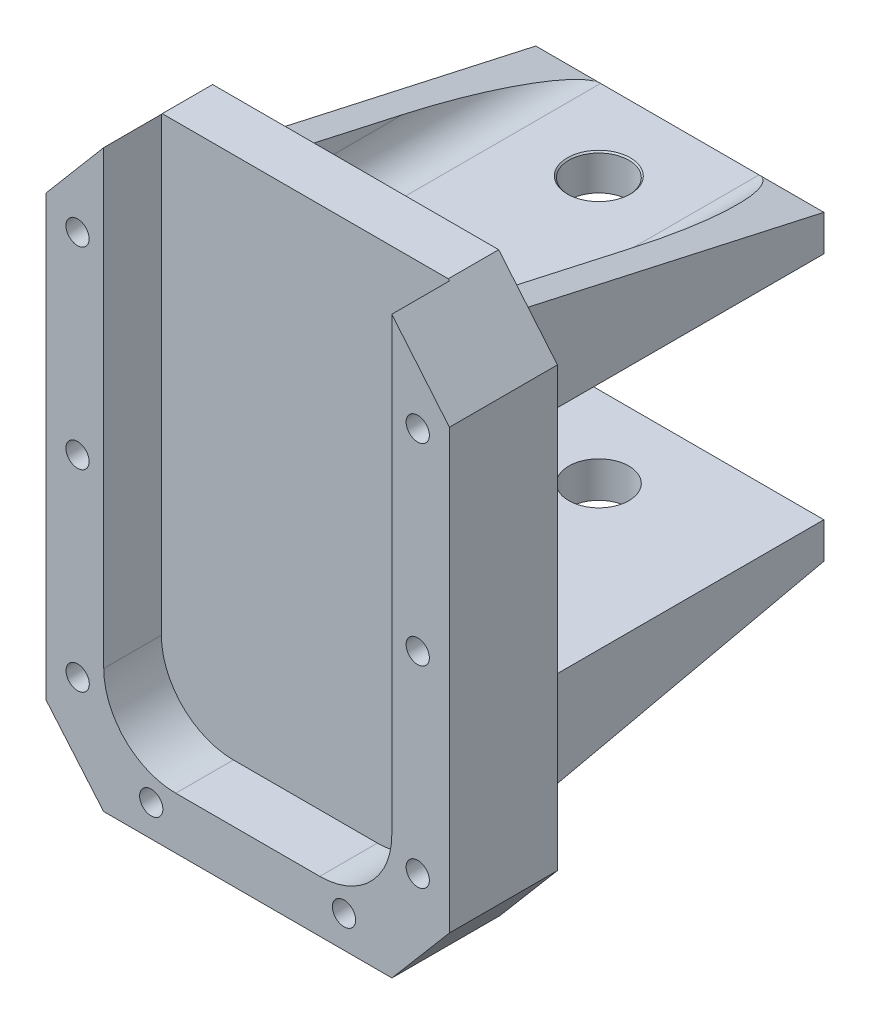
from build123d import *

# Parameters (mm, degrees)
SKETCH1_W                      = 35.56
SKETCH1_H                      = 50.8
BOSS_EXTRUDE1_DEPTH            = 9.525
SKETCH2_W                      = 25.4
SKETCH2_H                      = 46.22
CUT_EXTRUDE2_DEPTH             = 5.08
TAP_DRILL_FOR_M2_5X0_45_TAP1_D = 2.05
SKETCH13_W                     = 25.4
SKETCH13_H                     = 3.175
BOSS_EXTRUDE2_DEPTH            = 28.575
CUT_EXTRUDE3_DEPTH             = 73.778867812
FILLET1_R                      = 6.35
M5_CLEARANCE_HOLE1_D           = 5.3
M5_CLEARANCE_HOLE1_CSINK_D     = 5.55
M5_CLEARANCE_HOLE1_CSINK_ANGLE = 90
RIB7_REACH                     = 67.774
SKETCH14_WALL_W                = 162.819779212
SKETCH14_WALL_H                = 2.54
RIB8_REACH                     = 67.774
SKETCH15_WALL_W                = 162.819779212
SKETCH15_WALL_H                = 2.54
RIB9_REACH                     = 67.774
SKETCH17_WALL_W                = 162.819779212
SKETCH17_WALL_H                = 2.54
RIB10_REACH                    = 67.774
SKETCH16_WALL_W                = 162.819779212
SKETCH16_WALL_H                = 2.54
FILLET2_R                      = 3.175
FILLET3_R                      = 3.175


with BuildPart() as part:
    # Sketch1 → Boss-Extrude1 (new body)
    with BuildSketch(Plane.XY):
        with Locations((-17.78, 25.4)):
            Rectangle(SKETCH1_W, SKETCH1_H)
    extrude(amount=BOSS_EXTRUDE1_DEPTH)

    # Sketch2 → Cut-Extrude2 (cut)
    with BuildSketch(Plane.XY.offset(9.525)):
        with Locations((-17.78, 27.69)):
            Rectangle(SKETCH2_W, SKETCH2_H)
    extrude(amount=-CUT_EXTRUDE2_DEPTH, mode=Mode.SUBTRACT)

    # Tap Drill for M2.5x0.45 Tap1 (through all)
    with Locations(Plane(origin=(0, 0, 0), x_dir=(-1, 0, 0), z_dir=(0, 0, -1))):
        with Locations((2.792369004, 43.087106138), (2.792369004, 26.092979092), (2.792369004, 9.105182099), (9.290740849, 2.822744672), (26.292369004, 2.787106138), (32.780032006, 9.105182099), (32.792369004, 26.087106138), (32.792369004, 43.087106138)):
            Hole(TAP_DRILL_FOR_M2_5X0_45_TAP1_D / 2)

    # Sketch13 → Boss-Extrude2 (add)
    with BuildSketch(Plane(origin=(0, 0, 0), x_dir=(-1, 0, 0), z_dir=(0, 0, -1))):
        with Locations((17.78, 37.827545037)):
            Rectangle(SKETCH13_W, SKETCH13_H)
        with Locations((17.78, 14.352545037)):
            Rectangle(SKETCH13_W, SKETCH13_H)
    extrude(amount=BOSS_EXTRUDE2_DEPTH)

    # Sketch8 → Cut-Extrude3 (cut, through all)
    with BuildSketch(Plane.XY.offset(9.525)):
        Polygon((-5.178964387, 50.8), (0, 44.591495864), (0, 50.8), align=None)
        Polygon((-35.56, 44.706622517), (-35.56, 50.8), (-30.402645731, 50.8), align=None)
        Polygon((-35.56, 5.970049098), (-35.56, 0), (-30.492594088, 0), align=None)
        Polygon((-5.092594088, -0.031324356), (0, 0), (0, 5.970049098), align=None)
    extrude(amount=-CUT_EXTRUDE3_DEPTH, mode=Mode.SUBTRACT)

    # Fillet1
    fillet1_edges = [part.edges().sort_by_distance(p)[0] for p in [
        (-5.08, 4.58, 6.985),
        (-30.48, 4.58, 6.985),
    ]]
    fillet(fillet1_edges, radius=FILLET1_R)

    # M5 Clearance Hole1 (through all)
    with Locations(Plane(origin=(-17.78, 39.415045037, -7.14375), x_dir=(0, 0, 1), z_dir=(0, 1, 0))):
        with Locations((0, 0), (-14.2875, 0)):
            CounterSinkHole(M5_CLEARANCE_HOLE1_D / 2, M5_CLEARANCE_HOLE1_CSINK_D / 2, counter_sink_angle=M5_CLEARANCE_HOLE1_CSINK_ANGLE)

    # Sketch14 wall → Rib7 (add, up to next)
    with BuildSketch(Plane(origin=(-30.48, 9.590045037, -14.2875), x_dir=(0, -0.216930457819, 0.976187060184), z_dir=(0, 0.976187060184, 0.216930457819)), mode=Mode.PRIVATE) as rib7_sk1:
        with Locations((0, 1.27)):
            Rectangle(SKETCH14_WALL_W, SKETCH14_WALL_H)
    rib7_tool1 = extrude(rib7_sk1.sketch, amount=RIB7_REACH, mode=Mode.PRIVATE) - part.part
    add(rib7_tool1.solids().sort_by_distance((-30.48, 9.590045037, -14.2875))[0])

    # Sketch15 wall → Rib8 (add, up to next)
    with BuildSketch(Plane(origin=(-5.08, 9.590045037, -14.2875), x_dir=(0, -0.216930457819, 0.976187060184), z_dir=(0, -0.976187060184, -0.216930457819)), mode=Mode.PRIVATE) as rib8_sk1:
        with Locations((0, 1.27)):
            Rectangle(SKETCH15_WALL_W, SKETCH15_WALL_H)
    rib8_tool1 = extrude(rib8_sk1.sketch, amount=-RIB8_REACH, mode=Mode.PRIVATE) - part.part
    add(rib8_tool1.solids().sort_by_distance((-5.08, 9.590045037, -14.2875))[0])

    # Sketch17 wall → Rib9 (add, up to next)
    with BuildSketch(Plane(origin=(-5.08, 42.590045037, -14.2875), x_dir=(0, 0.216930457819, 0.976187060184), z_dir=(0, -0.976187060184, 0.216930457819)), mode=Mode.PRIVATE) as rib9_sk1:
        with Locations((0, 1.27)):
            Rectangle(SKETCH17_WALL_W, SKETCH17_WALL_H)
    rib9_tool1 = extrude(rib9_sk1.sketch, amount=RIB9_REACH, mode=Mode.PRIVATE) - part.part
    add(rib9_tool1.solids().sort_by_distance((-5.08, 42.590045037, -14.2875))[0])

    # Sketch16 wall → Rib10 (add, up to next)
    with BuildSketch(Plane(origin=(-30.48, 42.590045037, -14.2875), x_dir=(0, 0.216930457819, 0.976187060184), z_dir=(0, 0.976187060184, -0.216930457819)), mode=Mode.PRIVATE) as rib10_sk1:
        with Locations((0, 1.27)):
            Rectangle(SKETCH16_WALL_W, SKETCH16_WALL_H)
    rib10_tool1 = extrude(rib10_sk1.sketch, amount=-RIB10_REACH, mode=Mode.PRIVATE) - part.part
    add(rib10_tool1.solids().sort_by_distance((-30.48, 42.590045037, -14.2875))[0])

    # Fillet2
    fillet2_edges = [part.edges().sort_by_distance(p)[0] for p in [
        (-27.94, 12.765045037, -14.2875),
        (-7.62, 12.765045037, -14.2875),
    ]]
    fillet(fillet2_edges, radius=FILLET2_R)

    # Fillet3
    fillet3_edges = [part.edges().sort_by_distance(p)[0] for p in [
        (-7.62, 39.415045037, -14.2875),
        (-27.94, 39.415045037, -14.2875),
    ]]
    fillet(fillet3_edges, radius=FILLET3_R)


solid = part.part
